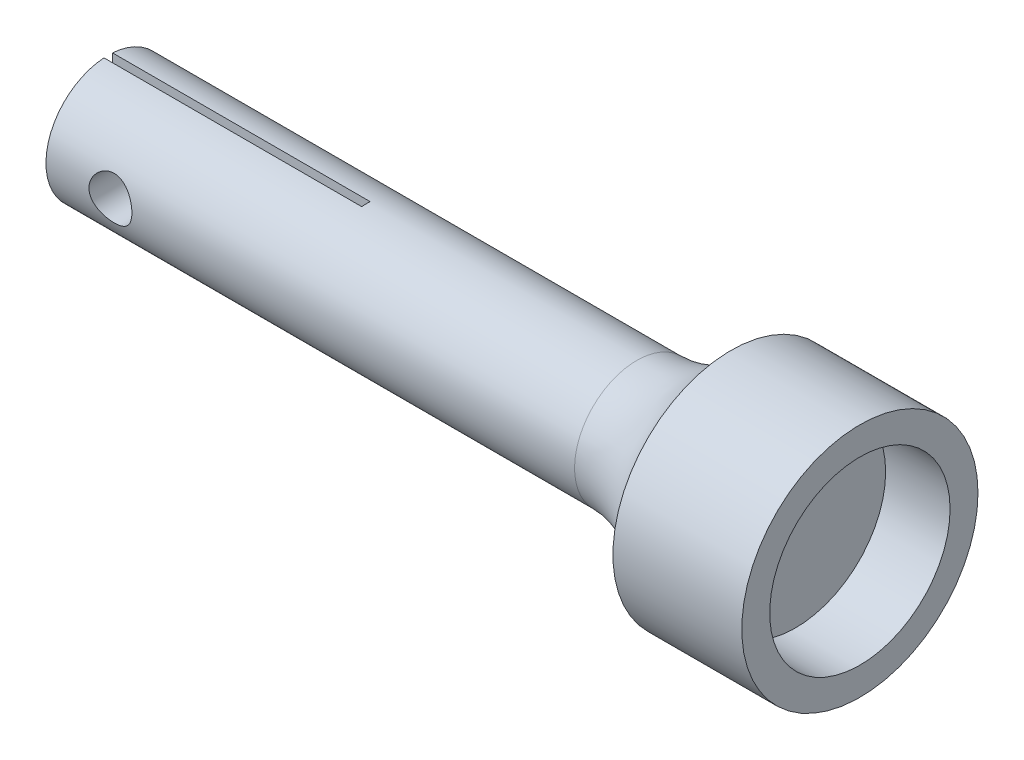
from build123d import *

# Parameters (mm, degrees)
SKETCH_1_R               = 2.9
EXTRUDE_1_DEPTH          = 35
SKETCH_2_W               = 0.4
SKETCH_2_H               = 5.450532248
CUT_EXTRUDE_1_DEPTH      = 12
CUT_EXTRUDE_2_DEPTH      = 10
CUT_EXTRUDE_2_DEPTH_BACK = 10
SKETCH_3_R               = 1
SKETCH_4_R               = 5.5
EXTRUDE_2_DEPTH          = 6
SKETCH_5_R               = 4.2
CUT_EXTRUDE_3_DEPTH      = 3
FILLET_1_R               = 5


with BuildPart() as part:
    # 草图1 → 凸台-拉伸1 (new body)
    with BuildSketch(Plane(origin=(0, 0, 0), x_dir=(0, 0, -1), z_dir=(1, 0, 0))):
        Circle(SKETCH_1_R)
    extrude(amount=EXTRUDE_1_DEPTH)

    # 草图2 → 切除-拉伸1 (cut)
    with BuildSketch(Plane.ZY):
        with Locations((0, 0.396255312)):
            Rectangle(SKETCH_2_W, SKETCH_2_H)
    extrude(amount=-CUT_EXTRUDE_1_DEPTH, mode=Mode.SUBTRACT)

    # 草图3 → 切除-拉伸2 (cut, two sides: drawn at the far end of the back side and taken through both)
    with BuildSketch(Plane(origin=(0, 0, 0.2), x_dir=(-1, 0, 0), z_dir=(0, 0, -1)).offset(-CUT_EXTRUDE_2_DEPTH_BACK)):
        with Locations(Location((-3, -0.003452386, 0), (0, 0, 270))):
            Circle(SKETCH_3_R)
    extrude(amount=CUT_EXTRUDE_2_DEPTH + CUT_EXTRUDE_2_DEPTH_BACK, mode=Mode.SUBTRACT)

    # 草图4 → 凸台-拉伸2 (add)
    with BuildSketch(Plane(origin=(35, 0, 0), x_dir=(0, 0, -1), z_dir=(1, 0, 0))):
        Circle(SKETCH_4_R)
    extrude(amount=-EXTRUDE_2_DEPTH)

    # 草图5 → 切除-拉伸3 (cut)
    with BuildSketch(Plane(origin=(35, 0, 0), x_dir=(0, 0, -1), z_dir=(1, 0, 0))):
        Circle(SKETCH_5_R)
    extrude(amount=-CUT_EXTRUDE_3_DEPTH, mode=Mode.SUBTRACT)

    # 圆角1
    # the kernel refuses this fillet: 5 mm, written as the material it adds along each edge
    with BuildSketch(Plane(origin=(29, 0, 0), x_dir=(0, 0, -1), z_dir=(0, 1, 0))) as fillet_1_piece_1:
        with BuildLine():
            CenterArc((7.9, 4.38634244), FILLET_1_R, 180, 61.314597986)
            Line((5.5, 0), (5.452, -0.087726849))
            ThreePointArc((5.452, -0.087726849), (4.2, -0.1), (2.9, -0.1))
            Line((2.9, -0.1), (2.8, 0))
            Line((2.8, 0), (2.8, 4.38634244))
            Line((2.8, 4.38634244), (2.9, 4.38634244))
        make_face()
    revolve(axis=Axis((29, 0, 0), (-1, 0, 0)))


solid = part.part
